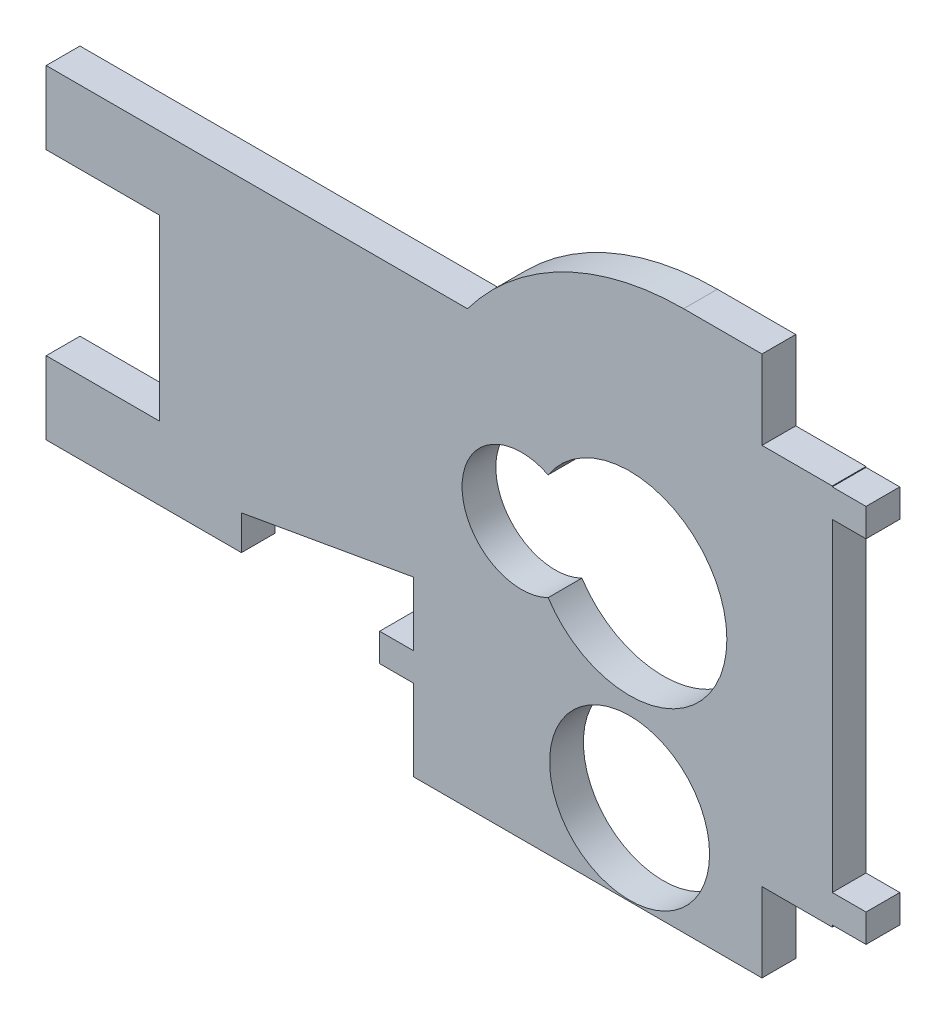
from build123d import *

# Parameters (mm, degrees)
SKETCH1_R           = 3.7592
BOSS_EXTRUDE1_DEPTH = 1.5875
CUT_EXTRUDE1_REACH  = 36.935
SKETCH2_W           = 3.302
SKETCH2_H           = 3.7211


with BuildPart() as part:
    # Sketch1 → Boss-Extrude1 (new body)
    with BuildSketch(Plane.XY):
        with BuildLine():
            Line((11.1125, 17.8308), (9.525, 17.8308))
            Line((9.525, 17.8308), (9.525, 21.59))
            Line((9.525, 21.59), (2.54, 21.59))
            ThreePointArc((2.54, 21.59), (-3.139612663, 20.249225326), (-7.62, 16.51))
            Line((-7.62, 16.51), (-27.418921519, 16.51))
            Line((-27.418921519, 16.51), (-27.418921519, 13.081))
            Line((-27.418921519, 13.081), (-22.084921519, 13.081))
            Line((-22.084921519, 13.081), (-22.084921519, 4.699))
            Line((-22.084921519, 4.699), (-27.418921519, 4.699))
            Line((-27.418921519, 4.699), (-27.418921519, 1.27))
            Line((-27.418921519, 1.27), (-18.241771939, 1.27))
            Line((-18.241771939, 1.27), (-18.241771939, 2.890724209))
            Line((-18.241771939, 2.890724209), (-10.16, 4.318))
            Line((-10.16, 4.318), (-10.16, 1.3208))
            Line((-10.16, 1.3208), (-11.7475, 1.3208))
            Line((-11.7475, 1.3208), (-11.7475, 0))
            Line((-11.7475, 0), (-10.16, 0))
            Line((-10.16, 0), (-10.16, -3.81))
            Line((-10.16, -3.81), (9.525, -3.81))
            Line((9.525, -3.81), (9.525, 0))
            Line((9.525, 0), (11.1125, 0))
            Line((11.1125, 0), (11.1125, 1.3208))
            Line((11.1125, 1.3208), (9.525, 1.3208))
            Line((9.525, 1.3208), (9.525, 16.51))
            Line((9.525, 16.51), (11.1125, 16.51))
            Line((11.1125, 16.51), (11.1125, 17.8308))
        make_face()
        with BuildLine():
            ThreePointArc((-3.82905, 6.645688551), (-7.874, 9.144), (-3.82905, 11.642311449))
            ThreePointArc((-3.82905, 11.642311449), (4.572, 9.144), (-3.82905, 6.645688551))
        make_face(mode=Mode.SUBTRACT)
        Circle(SKETCH1_R, mode=Mode.SUBTRACT)
    extrude(amount=BOSS_EXTRUDE1_DEPTH)

    # Sketch2 → Cut-Extrude1 (cut, up to next)
    with BuildSketch(Plane.XY.offset(1.5875), mode=Mode.PRIVATE) as cut_extrude1_sk1:
        with Locations((7.874, -1.94945)):
            Rectangle(SKETCH2_W, SKETCH2_H)
    cut_extrude1_tool1 = extrude(cut_extrude1_sk1.sketch, amount=-CUT_EXTRUDE1_REACH, mode=Mode.PRIVATE) & part.part
    # Sketch2 → Cut-Extrude1 (cut, up to next)
    with BuildSketch(Plane.XY.offset(1.5875), mode=Mode.PRIVATE) as cut_extrude1_sk2:
        with Locations((7.874, 19.72945)):
            Rectangle(SKETCH2_W, SKETCH2_H)
    cut_extrude1_tool2 = extrude(cut_extrude1_sk2.sketch, amount=-CUT_EXTRUDE1_REACH, mode=Mode.PRIVATE) & part.part
    add(cut_extrude1_tool1.solids().sort_by_distance((7.874, -1.94945, 1.5875))[0], mode=Mode.SUBTRACT)
    add(cut_extrude1_tool2.solids().sort_by_distance((7.874, 19.72945, 1.5875))[0], mode=Mode.SUBTRACT)


solid = part.part
